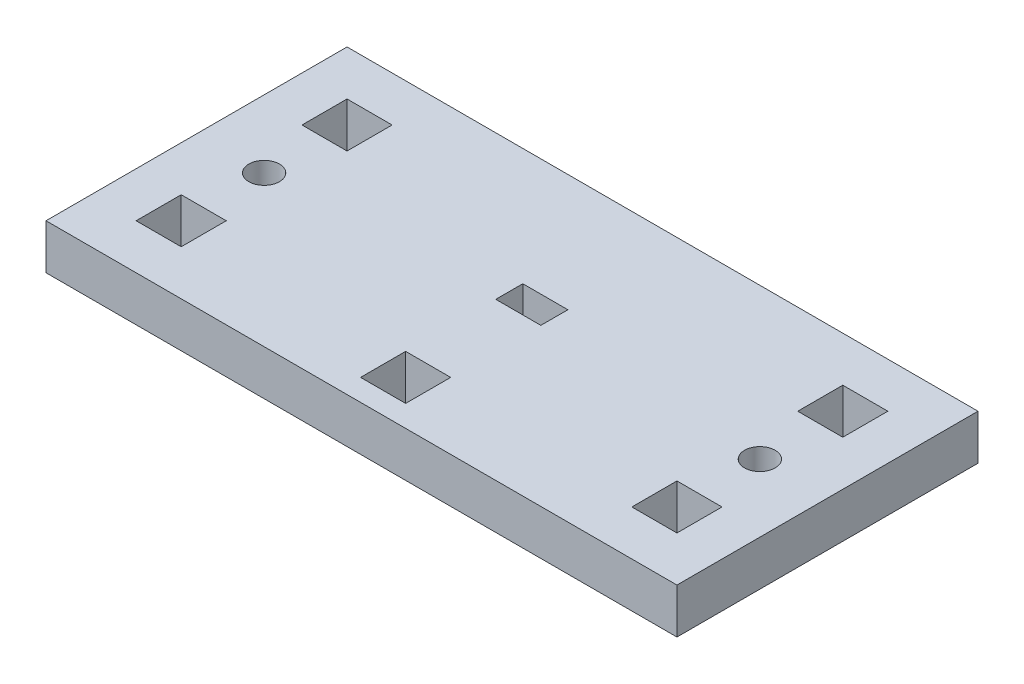
from build123d import *

# Parameters (mm, degrees)
SKETCH1_W           = 88.9
SKETCH1_H           = 42.418
SKETCH1_R           = 2.159
SKETCH1_W_2         = 6.35
SKETCH1_H_2         = 6.35
SKETCH1_H_3         = 3.81
BOSS_EXTRUDE1_DEPTH = 6.35


with BuildPart() as part:
    # Sketch1 → Boss-Extrude1 (new body)
    with BuildSketch(Plane(origin=(0, 0, 0), x_dir=(1, 0, 0), z_dir=(0, 1, 0))):
        Rectangle(SKETCH1_W, SKETCH1_H)
        with Locations((34.925, 0)):
            Circle(SKETCH1_R, mode=Mode.SUBTRACT)
        with Locations((-34.925, 0)):
            Circle(SKETCH1_R, mode=Mode.SUBTRACT)
        with Locations((0, -14.986)):
            Rectangle(SKETCH1_W_2, SKETCH1_H_2, mode=Mode.SUBTRACT)
        with Locations((0, 2.794)):
            Rectangle(SKETCH1_W_2, SKETCH1_H_3, mode=Mode.SUBTRACT)
        with Locations((34.925, 11.684)):
            Rectangle(SKETCH1_W_2, SKETCH1_H_2, mode=Mode.SUBTRACT)
        with Locations((34.925, -11.684)):
            Rectangle(SKETCH1_W_2, SKETCH1_H_2, mode=Mode.SUBTRACT)
        with Locations((-34.925, 11.684)):
            Rectangle(SKETCH1_W_2, SKETCH1_H_2, mode=Mode.SUBTRACT)
        with Locations((-34.925, -11.684)):
            Rectangle(SKETCH1_W_2, SKETCH1_H_2, mode=Mode.SUBTRACT)
    extrude(amount=BOSS_EXTRUDE1_DEPTH)


solid = part.part
